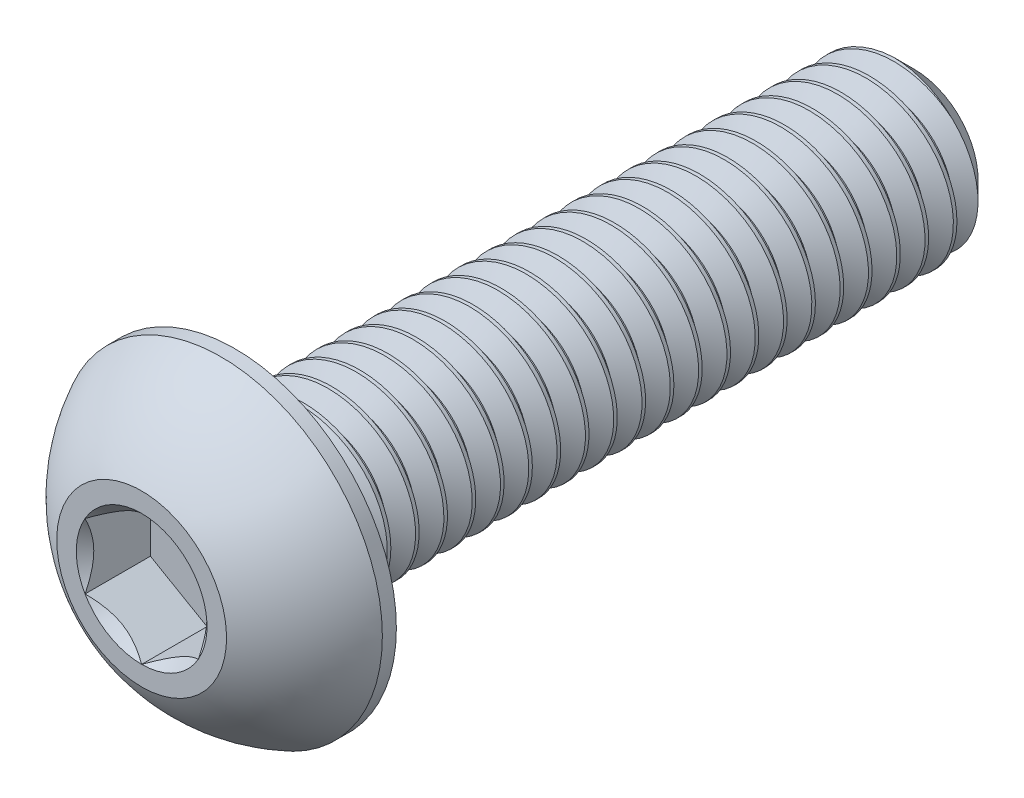
from build123d import *

# Parameters (mm, degrees)
SKETCH1_W          = 12
SKETCH1_H          = 1.5
CHAMFER1_SIZE      = 0.375
CUT_EXTRUDE2_DEPTH = 1.155
CUT_SWEEP1_PITCH   = 0.5


with BuildPart() as part:
    # Sketch1 → Revolve1 (revolve)
    with BuildSketch(Plane(origin=(0, 0, 0), x_dir=(0, 0, -1), z_dir=(1, 0, 0))):
        with Locations((7.65, 0.75)):
            Rectangle(SKETCH1_W, SKETCH1_H)
    revolve(axis=Axis((0, 0, -13.65), (0, 0, 1)))

    # Chamfer1
    chamfer1_edges = [part.edges().sort_by_distance(p)[0] for p in [
        (0, -1.5, -13.65),
    ]]
    chamfer(chamfer1_edges, length=CHAMFER1_SIZE)

    # Sketch7 → Revolve2 (revolve)
    with BuildSketch(Plane(origin=(0, 0, 0), x_dir=(0, 0, -1), z_dir=(1, 0, 0)), mode=Mode.PRIVATE) as revolve2_sk:
        with BuildLine():
            Line((1.4025, 2.85), (1.65, 2.85))
            Line((1.65, 2.85), (1.65, 0))
            Line((1.65, 0), (0, 0))
            Line((0, 0), (0, 1.5))
            ThreePointArc((0, 1.5), (0.59512511, 2.285251969), (1.4025, 2.85))
        make_face()
    revolve(revolve2_sk.sketch.rotate(Axis((0, 0, 0), (0, 0, -1)), 180), axis=Axis((0, 0, 0), (0, 0, -1)))

    # Sketch5 → Cut-Extrude2 (cut)
    with BuildSketch(Plane.XY):
        Polygon((1, -0.577350269), (1, 0.577350269), (0, 1.154700538), (-1, 0.577350269), (-1, -0.577350269), (0, -1.154700538), align=None)
    extrude(amount=-CUT_EXTRUDE2_DEPTH, mode=Mode.SUBTRACT)

    # Cut-Extrude3 cone 1 section (through the dimple's axis) → Cut-Extrude3 (revolve, cut)
    with BuildSketch(Plane(origin=(0, 0, 0), x_dir=(0, -1, 0), z_dir=(1, 0, 0))):
        Polygon((0, 0), (1.154700538, 0), (0, 1.154700538), align=None)
    revolve(axis=Axis((0, 0, 0), (0, 0, -1)), mode=Mode.SUBTRACT)

    # Cut-Sweep1: the profile of Sketch2 profile screwed along a right-hand helix of 25 turns, 6 arcs to a turn; built about Z, then put on its axis
    cut_sweep1_z = Axis((0, 0, 0), (0, 0, 1))
    cut_sweep1_corners = [(1.5006, 0, 0.37534641), (1.5006, 0, -0.06284641), (1.175240474, 0, 0.125), (1.175240474, 0, 0.1875)]
    with BuildLine(mode=Mode.PRIVATE) as cut_sweep1_profile:
        Line(cut_sweep1_corners[0], cut_sweep1_corners[1])
        Line(cut_sweep1_corners[1], cut_sweep1_corners[2])
        Line(cut_sweep1_corners[2], cut_sweep1_corners[3])
        Line(cut_sweep1_corners[3], cut_sweep1_corners[0])
    cut_sweep1_cap = Face(cut_sweep1_profile.wire())
    cut_sweep1_turn_angles = [0, 30, 60, 90, 120, 150, 180, 210, 240, 270, 300, 330, 360]
    cut_sweep1_turn_weights = [1, 0.8660254037844387, 1, 0.8660254037844387, 1, 0.8660254037844387, 1, 0.8660254037844387, 1, 0.8660254037844387, 1, 0.8660254037844387, 1]
    cut_sweep1_turn_rails = [Edge.make_bspline([Vector(p[0], p[1], 0).rotate(cut_sweep1_z, cut_sweep1_turn_angles[k]) / cut_sweep1_turn_weights[k] + Vector(0, 0, p[2] + CUT_SWEEP1_PITCH * cut_sweep1_turn_angles[k] / 360) for k in range(13)], [0, 0, 0, 1, 1, 2, 2, 3, 3, 4, 4, 5, 5, 6, 6, 6], 2, cut_sweep1_turn_weights) for p in cut_sweep1_corners]
    cut_sweep1_turn_sides = [Face.make_surface_from_curves(cut_sweep1_turn_rails[p[0]], cut_sweep1_turn_rails[p[1]]) for p in [(0, 1), (1, 2), (2, 3), (3, 0)]]
    cut_sweep1 = Plane(origin=(0, 0, -13.65), x_dir=(0, 1, 0), z_dir=(0, 0, 1)) * Solid(Shell([*[p.moved(Location((0, 0, CUT_SWEEP1_PITCH * i))) for i in range(25) for p in cut_sweep1_turn_sides], cut_sweep1_cap, cut_sweep1_cap.rotate(cut_sweep1_z, 9000).moved(Location((0, 0, CUT_SWEEP1_PITCH * 9000 / 360)))]))
    add(cut_sweep1, mode=Mode.SUBTRACT)


solid = part.part
